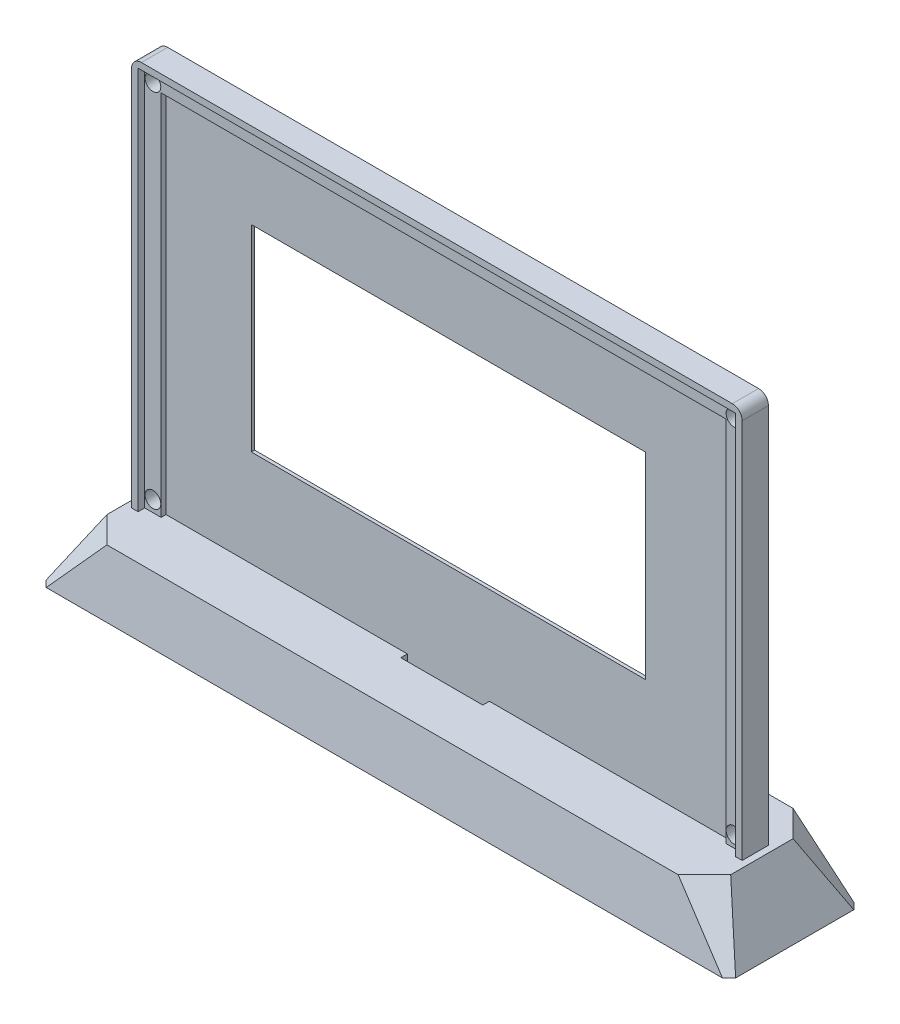
from build123d import *

# Parameters (mm, degrees)
SKETCH_3_W          = 186
SKETCH_3_H          = 8
EXTRUDE_1_DEPTH     = 119
SKETCH_9_R          = 2.5
CUT_EXTRUDE_1_DEPTH = 5
SKETCH_10_W         = 172
SKETCH_10_H         = 112
CUT_EXTRUDE_2_DEPTH = 3.5
SKETCH_11_W         = 120
SKETCH_11_H         = 60
CUT_EXTRUDE_3_DEPTH = 10
SKETCH_12_W         = 182
SKETCH_12_H         = 117
CUT_EXTRUDE_4_DEPTH = 2
SKETCH_15_W         = 25
SKETCH_15_H         = 2
CUT_EXTRUDE_8_DEPTH = 12
SKETCH_13_R         = 2.4
CUT_EXTRUDE_7_DEPTH = 12
MIRROR_START        = -14.334518618
MIRROR_3_DEPTH      = 20.078011551
FILLET_1_R          = 3


# Read off the part's stored shape, not the designer's step: 镜向3
with BuildPart() as part:
    # 草图1 → 放样1 section 0
    with BuildSketch(Plane(origin=(0, 0, 0), x_dir=(1, 0, 0), z_dir=(0, 1, 0))):
        with BuildLine():
            Line((-105, 20), (105, 20))
            Line((105, 20), (105, -20))
            Line((105, -20), (-105, -20))
            Line((-105, -20), (-105, 20))
        make_face()
    # 草图2 → 放样1 section 1
    with BuildSketch(Plane(origin=(0, 18, 0), x_dir=(1, 0, 0), z_dir=(0, 1, 0))):
        with BuildLine():
            Line((-95, 17.5), (95, 17.5))
            Line((95, 17.5), (95, -17.5))
            Line((95, -17.5), (-95, -17.5))
            Line((-95, -17.5), (-95, 17.5))
        make_face()
    loft()

    # 草图3 → 凸台-拉伸1 (add)
    with BuildSketch(Plane(origin=(0, 18, 0), x_dir=(1, 0, 0), z_dir=(0, 1, 0))):
        Rectangle(SKETCH_3_W, SKETCH_3_H)
    extrude(amount=EXTRUDE_1_DEPTH)

    # 草图5 → 切除-放样2 section 0
    with BuildSketch(Plane.XZ):
        with BuildLine():
            Line((-85, 15), (85, 15))
            Line((85, 15), (85, -15))
            Line((85, -15), (-85, -15))
            Line((-85, -15), (-85, 15))
        make_face()
    # 草图7 → 切除-放样2 section 1
    with BuildSketch(Plane(origin=(0, 11, 0), x_dir=(1, 0, 0), z_dir=(0, 1, 0))):
        with BuildLine():
            Line((-75, 12.5), (75, 12.5))
            Line((75, 12.5), (75, -12.5))
            Line((75, -12.5), (-75, -12.5))
            Line((-75, -12.5), (-75, 12.5))
        make_face()
    loft(mode=Mode.SUBTRACT)

    # 草图9 → 切除-拉伸1 (cut)
    with BuildSketch(Plane.XZ):
        with Locations(Location((95, 15, 0), (0, 0, 270))):
            Circle(SKETCH_9_R)
        with Locations(Location((-95, 15, 0), (0, 0, 270))):
            Circle(SKETCH_9_R)
        with Locations(Location((-95, -15, 0), (0, 0, 270))):
            Circle(SKETCH_9_R)
        with Locations(Location((95, -15, 0), (0, 0, 270))):
            Circle(SKETCH_9_R)
    extrude(amount=-CUT_EXTRUDE_1_DEPTH, mode=Mode.SUBTRACT)

    # 草图10 → 切除-拉伸2 (cut)
    with BuildSketch(Plane.XY.offset(4)):
        with Locations((0, 74)):
            Rectangle(SKETCH_10_W, SKETCH_10_H)
    cut_extrude_2 = extrude(amount=-CUT_EXTRUDE_2_DEPTH, mode=Mode.SUBTRACT)

    # 草图11 → 切除-拉伸3 (cut)
    with BuildSketch(Plane.XY.offset(0.5)):
        with Locations((0, 77.5)):
            Rectangle(SKETCH_11_W, SKETCH_11_H)
    extrude(amount=-CUT_EXTRUDE_3_DEPTH, mode=Mode.SUBTRACT)

    # 草图12 → 切除-拉伸4 (cut)
    with BuildSketch(Plane.XY.offset(4)):
        with Locations((0, 76.5)):
            Rectangle(SKETCH_12_W, SKETCH_12_H)
    cut_extrude_4 = extrude(amount=-CUT_EXTRUDE_4_DEPTH, mode=Mode.SUBTRACT)

    # 草图15 → 切除-拉伸8 (cut)
    with BuildSketch(Plane(origin=(0, 18, 0), x_dir=(1, 0, 0), z_dir=(0, 1, 0))):
        with Locations((0, -1.5)):
            Rectangle(SKETCH_15_W, SKETCH_15_H)
    cut_extrude_8 = extrude(amount=-CUT_EXTRUDE_8_DEPTH, mode=Mode.SUBTRACT)

    # 镜向1: 切除-拉伸2, 切除-拉伸4, 切除-拉伸8 across plane
    add(cut_extrude_2.mirror(Plane.XY), mode=Mode.SUBTRACT)
    add(cut_extrude_4.mirror(Plane.XY), mode=Mode.SUBTRACT)
    add(cut_extrude_8.mirror(Plane.XY), mode=Mode.SUBTRACT)

    # 草图13 → 切除-拉伸7 (cut)
    with BuildSketch(Plane.XY.offset(2)):
        with Locations((88.5, 131.5)):
            Circle(SKETCH_13_R)
        with Locations((88.5, 21.5)):
            Circle(SKETCH_13_R)
        with Locations((-88.5, 21.5)):
            Circle(SKETCH_13_R)
        with Locations((-88.5, 131.5)):
            Circle(SKETCH_13_R)
    extrude(amount=-CUT_EXTRUDE_7_DEPTH, mode=Mode.SUBTRACT)

    # 草图17 → 切除-放样3 section 0
    with BuildSketch(Plane(origin=(0, 18, 0), x_dir=(1, 0, 0), z_dir=(0, 1, 0))):
        with BuildLine():
            Line((87, 17.5), (95, 17.5))
            Line((95, 17.5), (95, 9.5))
            Line((95, 9.5), (87, 17.5))
        make_face()
    # 草图18 → 切除-放样3 section 1
    with BuildSketch(Plane(origin=(0, 0, 0), x_dir=(1, 0, 0), z_dir=(0, 1, 0))):
        with BuildLine():
            Line((103, 20), (105, 20))
            Line((105, 20), (105, 18))
            Line((105, 18), (103, 20))
        make_face()
    loft_3 = loft(mode=Mode.SUBTRACT)

    # 镜向2: 切除-放样3 across plane
    add(loft_3.mirror(Plane(origin=(0, 0, 0), x_dir=(0, 0, 1), z_dir=(1, 0, 0))), mode=Mode.SUBTRACT)

    # 镜向3 outline → 镜向3 (cut)
    with BuildSketch(Plane(origin=(0, 0, 0), x_dir=(1, 0, 0), z_dir=(0, 0.6973549598034537, -0.7167259309091051)).offset(MIRROR_START)):
        Polygon((-84.282271503, -27), (-87, -25.104778553), (-105, -12.552389276), (-106, -11.855034316), (-106, -27), align=None)
        Polygon((87, -25.104778553), (84.282271503, -27), (106, -27), (106, -11.855034316), (105, -12.552389276), align=None)
    extrude(amount=MIRROR_3_DEPTH, mode=Mode.SUBTRACT)

    # 圆角1
    fillet_1_edges = [part.edges().sort_by_distance(p)[0] for p in [
        (93, 137, 0),
        (-93, 137, 0),
    ]]
    fillet(fillet_1_edges, radius=FILLET_1_R)


solid = part.part
